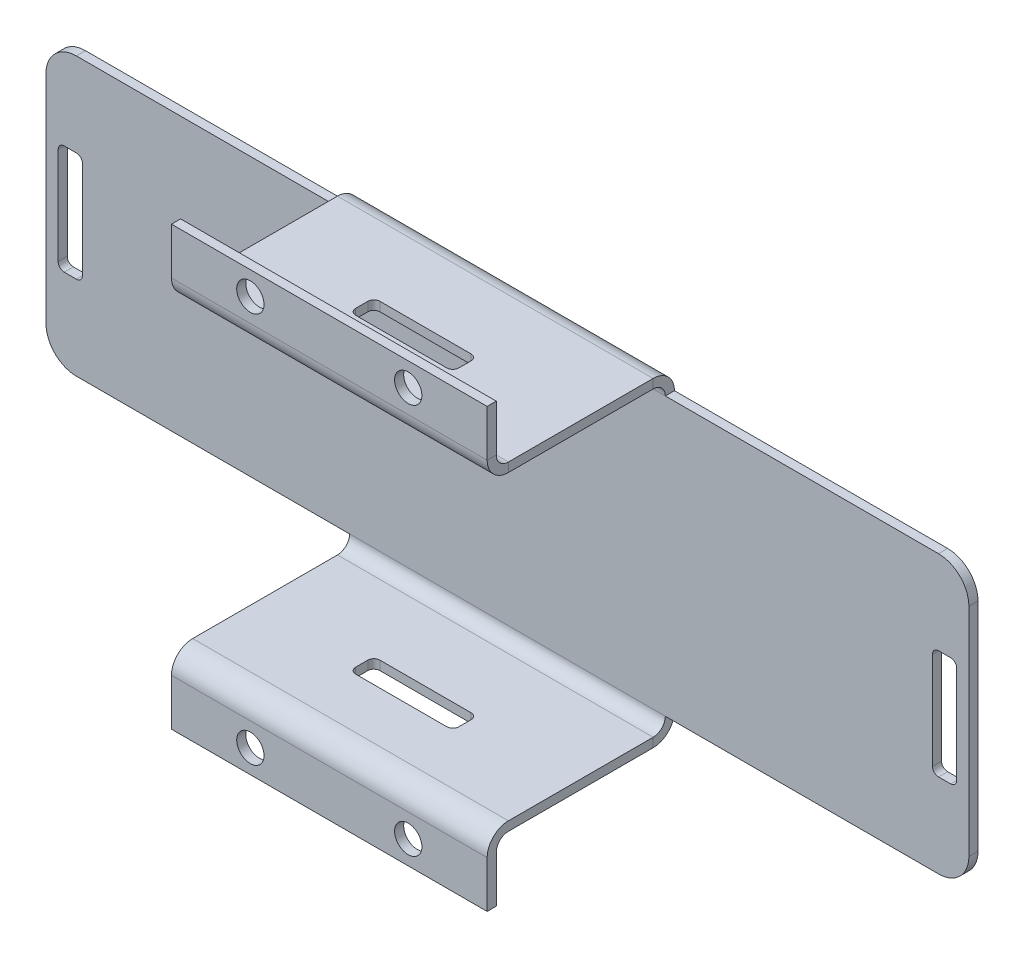
from build123d import *

# Parameters (mm, degrees)
SKIZZE1_W                            = 152
SKIZZE1_H                            = 126
BASIS_BLECH1_DEPTH                   = 1.5
SKIZZIERTE_BIEGUNG2_DEPTH            = 152
SKIZZIERTE_BIEGUNG2_2_DEPTH          = 152
SKIZZIERTE_BIEGUNG3_DEPTH            = 152
SKIZZIERTE_BIEGUNG3_2_DEPTH          = 152
SKIZZIERTE_BIEGUNG4_DEPTH            = 152
SKIZZIERTE_BIEGUNG4_2_DEPTH          = 152
SCHNITT_LINEAR_AUSTRAGEN1_DEPTH      = 50
SCHNITT_LINEAR_AUSTRAGEN2_DEPTH      = 167.894252898
SCHNITT_LINEAR_AUSTRAGEN2_DEPTH_BACK = 167.894252898
SKIZZE15_W                           = 17
SKIZZE15_H                           = 4
SKIZZE22_R                           = 2.25
SCHNITT_LINEAR_AUSTRAGEN4_DEPTH      = 185.011324876
VERRUNDUNG3_R                        = 1
VERRUNDUNG4_R                        = 5
SCHNITT_LINEAR_AUSTRAGEN5_DEPTH      = 184.765876096


# Read off the part's stored shape, not the designer's step: Skizzierte Biegung2, Skizzierte Biegung3, Skizzierte Biegung4
# Sheet-metal steps are written as plain solids
with BuildPart() as part:
    # Skizze1 → Basis-Blech1 (new body)
    with BuildSketch(Plane.XY):
        with Locations((76, 63)):
            Rectangle(SKIZZE1_W, SKIZZE1_H)
    extrude(amount=-BASIS_BLECH1_DEPTH)

    # Skizzierte Biegung2 outline → Skizzierte Biegung2 (cut)
    with BuildSketch(Plane.YZ):
        with BuildLine():
            ThreePointArc((88.712436374, 0), (87.460340225, -1.102418411), (85.840155051, -1.5))
            Line((85.840155051, -1.5), (126, -1.5))
            Line((126, -1.5), (126, 0))
            Line((126, 0), (88.712436374, 0))
        make_face()
        with BuildLine():
            Line((0, -1.5), (40.159844949, -1.5))
            ThreePointArc((40.159844949, -1.5), (38.539659775, -1.102418411), (37.287563626, 0))
            Line((37.287563626, 0), (0, 0))
            Line((0, 0), (0, -1.5))
        make_face()
    extrude(amount=SKIZZIERTE_BIEGUNG2_DEPTH, mode=Mode.SUBTRACT)

    # Skizzierte Biegung2 2 outline → Skizzierte Biegung2 2 (add)
    with BuildSketch(Plane.YZ):
        with BuildLine():
            Line((85.840155051, 0), (88.712436374, 0))
            ThreePointArc((88.712436374, 0), (89.179540071, 0.951902827), (89.340155051, 2))
            Line((89.340155051, 2), (89.340155051, 37.840155051))
            Line((89.340155051, 37.840155051), (87.840155051, 37.840155051))
            Line((87.840155051, 37.840155051), (87.840155051, 2))
            ThreePointArc((87.840155051, 2), (87.254368613, 0.585786438), (85.840155051, 0))
        make_face()
        with BuildLine():
            ThreePointArc((36.659844949, 2), (36.820459929, 0.951902827), (37.287563626, 0))
            Line((37.287563626, 0), (40.159844949, 0))
            ThreePointArc((40.159844949, 0), (38.745631387, 0.585786438), (38.159844949, 2))
            Line((38.159844949, 2), (38.159844949, 37.840155051))
            Line((38.159844949, 37.840155051), (36.659844949, 37.840155051))
            Line((36.659844949, 37.840155051), (36.659844949, 2))
        make_face()
    extrude(amount=SKIZZIERTE_BIEGUNG2_2_DEPTH)

    # Skizzierte Biegung3 outline → Skizzierte Biegung3 (cut)
    with BuildSketch(Plane.YZ):
        with BuildLine():
            ThreePointArc((87.840155051, 25.840155051), (88.23773664, 27.460340225), (89.340155051, 28.712436374))
            Line((89.340155051, 28.712436374), (89.340155051, 37.840155051))
            Line((89.340155051, 37.840155051), (87.840155051, 37.840155051))
            Line((87.840155051, 37.840155051), (87.840155051, 25.840155051))
        make_face()
    extrude(amount=SKIZZIERTE_BIEGUNG3_DEPTH, mode=Mode.SUBTRACT)

    # Skizzierte Biegung3 2 outline → Skizzierte Biegung3 2 (add)
    with BuildSketch(Plane.YZ):
        with BuildLine():
            ThreePointArc((89.340155051, 25.840155051), (89.925941489, 27.254368613), (91.340155051, 27.840155051))
            Line((91.340155051, 27.840155051), (99.020465152, 27.840155051))
            Line((99.020465152, 27.840155051), (99.020465152, 29.340155051))
            Line((99.020465152, 29.340155051), (91.340155051, 29.340155051))
            ThreePointArc((91.340155051, 29.340155051), (90.292057878, 29.179540071), (89.340155051, 28.712436374))
            Line((89.340155051, 28.712436374), (89.340155051, 25.840155051))
        make_face()
    extrude(amount=SKIZZIERTE_BIEGUNG3_2_DEPTH)

    # Skizzierte Biegung4 outline → Skizzierte Biegung4 (cut)
    with BuildSketch(Plane.YZ):
        with BuildLine():
            Line((36.659844949, 37.840155051), (36.659844949, 28.712436374))
            ThreePointArc((36.659844949, 28.712436374), (37.76226336, 27.460340225), (38.159844949, 25.840155051))
            Line((38.159844949, 25.840155051), (38.159844949, 37.840155051))
            Line((38.159844949, 37.840155051), (36.659844949, 37.840155051))
        make_face()
    extrude(amount=SKIZZIERTE_BIEGUNG4_DEPTH, mode=Mode.SUBTRACT)

    # Skizzierte Biegung4 2 outline → Skizzierte Biegung4 2 (add)
    with BuildSketch(Plane.YZ):
        with BuildLine():
            Line((26.979534848, 29.340155051), (26.979534848, 27.840155051))
            Line((26.979534848, 27.840155051), (34.659844949, 27.840155051))
            ThreePointArc((34.659844949, 27.840155051), (36.074058511, 27.254368614), (36.659844949, 25.840155051))
            Line((36.659844949, 25.840155051), (36.659844949, 28.712436374))
            ThreePointArc((36.659844949, 28.712436374), (35.707942122, 29.179540071), (34.659844949, 29.340155051))
            Line((34.659844949, 29.340155051), (26.979534848, 29.340155051))
        make_face()
    extrude(amount=SKIZZIERTE_BIEGUNG4_2_DEPTH)

    # Skizze14 → Schnitt-Linear austragen1 (cut)
    with BuildSketch(Plane.ZY):
        with BuildLine():
            Line((29.340155051, 91.340155051), (29.340155051, 99.020465152))
            Line((29.340155051, 99.020465152), (27.840155051, 99.020465152))
            Line((27.840155051, 99.020465152), (27.840155051, 91.340155051))
            ThreePointArc((27.840155051, 91.340155051), (27.254368613, 89.925941488), (25.840155051, 89.340155051))
            Line((25.840155051, 89.340155051), (2, 89.340155051))
            ThreePointArc((2, 89.340155051), (-0.474873734, 88.315028785), (-1.5, 85.840155051))
            Line((-1.5, 85.840155051), (0, 85.840155051))
            ThreePointArc((0, 85.840155051), (0.585786438, 87.254368613), (2, 87.840155051))
            Line((2, 87.840155051), (25.840155051, 87.840155051))
            ThreePointArc((25.840155051, 87.840155051), (28.315028785, 88.865281317), (29.340155051, 91.340155051))
        make_face()
        with BuildLine():
            Line((0, 40.159844949), (-1.5, 40.159844949))
            ThreePointArc((-1.5, 40.159844949), (-0.474873734, 37.684971215), (2, 36.659844949))
            Line((2, 36.659844949), (25.840155051, 36.659844949))
            ThreePointArc((25.840155051, 36.659844949), (27.254368613, 36.074058512), (27.840155051, 34.659844949))
            Line((27.840155051, 34.659844949), (27.840155051, 26.979534848))
            Line((27.840155051, 26.979534848), (29.340155051, 26.979534848))
            Line((29.340155051, 26.979534848), (29.340155051, 34.659844949))
            ThreePointArc((29.340155051, 34.659844949), (28.315028785, 37.134718683), (25.840155051, 38.159844949))
            Line((25.840155051, 38.159844949), (2, 38.159844949))
            ThreePointArc((2, 38.159844949), (0.585786438, 38.745631387), (0, 40.159844949))
        make_face()
    schnitt_linear_austragen1 = extrude(amount=-SCHNITT_LINEAR_AUSTRAGEN1_DEPTH, mode=Mode.SUBTRACT)

    # Spiegeln1: Schnitt-Linear austragen1 across plane
    add(schnitt_linear_austragen1.mirror(Plane(origin=(76, 0, 0), x_dir=(0, 0, 1), z_dir=(1, 0, 0))), mode=Mode.SUBTRACT)

    # Skizze15 → Schnitt-Linear austragen2 (cut, two sides: drawn at the far end of the back side and taken through both)
    with BuildSketch(Plane.XZ.offset(-36.659844949).offset(-SCHNITT_LINEAR_AUSTRAGEN2_DEPTH_BACK)):
        with Locations((76, 15.5)):
            Rectangle(SKIZZE15_W, SKIZZE15_H)
    extrude(amount=SCHNITT_LINEAR_AUSTRAGEN2_DEPTH + SCHNITT_LINEAR_AUSTRAGEN2_DEPTH_BACK, mode=Mode.SUBTRACT)

    # Skizze22 → Schnitt-Linear austragen4 (cut, through all)
    with BuildSketch(Plane.XY.offset(29.340155051)):
        with Locations((63, 95.180310101)):
            Circle(SKIZZE22_R)
        with Locations((89, 95.180310101)):
            Circle(SKIZZE22_R)
        with Locations((63, 30.819689899)):
            Circle(SKIZZE22_R)
        with Locations((89, 30.819689899)):
            Circle(SKIZZE22_R)
    extrude(amount=-SCHNITT_LINEAR_AUSTRAGEN4_DEPTH, mode=Mode.SUBTRACT)

    # Verrundung3
    verrundung3_edges = [part.edges().sort_by_distance(p)[0] for p in [
        (67.5, 88.590155051, 13.5),
        (67.5, 37.409844949, 13.5),
        (67.5, 88.590155051, 17.5),
        (67.5, 37.409844949, 17.5),
        (84.5, 88.590155051, 17.5),
        (84.5, 37.409844949, 17.5),
        (84.5, 88.590155051, 13.5),
        (84.5, 37.409844949, 13.5),
    ]]
    fillet(verrundung3_edges, radius=VERRUNDUNG3_R)

    # Verrundung4
    verrundung4_edges = [part.edges().sort_by_distance(p)[0] for p in [
        (0, 85.840155051, -0.75),
        (152, 85.840155051, -0.75),
        (152, 40.159844949, -0.75),
        (0, 40.159844949, -0.75),
    ]]
    fillet(verrundung4_edges, radius=VERRUNDUNG4_R)

    # Skizze23 → Schnitt-Linear austragen5 (cut, through all)
    with BuildSketch(Plane.XY):
        with BuildLine():
            Line((3, 72), (5, 72))
            ThreePointArc((5, 72), (5.707106781, 71.707106781), (6, 71))
            Line((6, 71), (6, 55))
            ThreePointArc((6, 55), (5.707106781, 54.292893219), (5, 54))
            Line((5, 54), (3, 54))
            ThreePointArc((3, 54), (2.292893219, 54.292893219), (2, 55))
            Line((2, 55), (2, 71))
            ThreePointArc((2, 71), (2.292893219, 71.707106781), (3, 72))
        make_face()
        with BuildLine():
            Line((149, 72), (147, 72))
            ThreePointArc((147, 72), (146.292893219, 71.707106781), (146, 71))
            Line((146, 71), (146, 55))
            ThreePointArc((146, 55), (146.292893219, 54.292893219), (147, 54))
            Line((147, 54), (149, 54))
            ThreePointArc((149, 54), (149.707106781, 54.292893219), (150, 55))
            Line((150, 55), (150, 71))
            ThreePointArc((150, 71), (149.707106781, 71.707106781), (149, 72))
        make_face()
    extrude(amount=-SCHNITT_LINEAR_AUSTRAGEN5_DEPTH, mode=Mode.SUBTRACT)


solid = part.part
